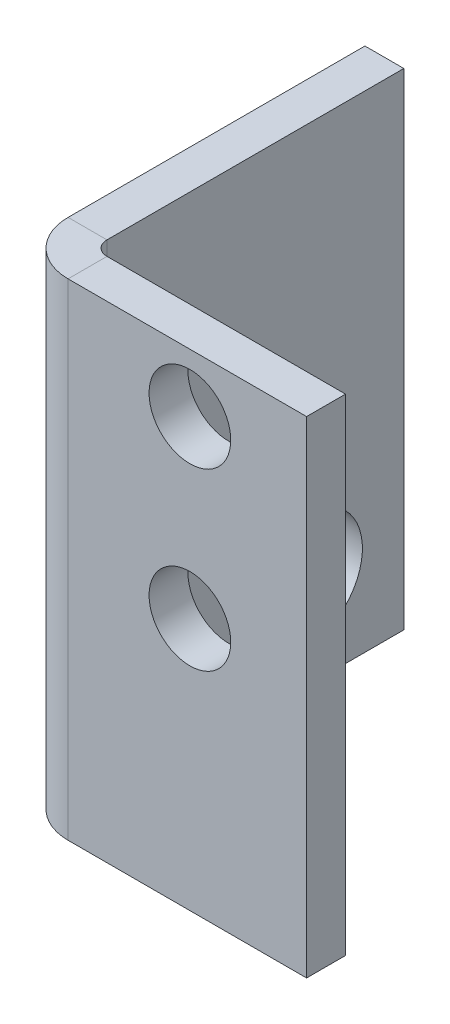
from build123d import *

# Parameters (mm, degrees)
SKETCH_1_W                       = 2
SKETCH_1_H                       = 25
SM_BASE_FLANGE_1_DEPTH           = 22
SM_EDGE_FLANGE_2_STRIP_W         = 9.4732
SM_EDGE_FLANGE_2_STRIP_H         = 2
SM_EDGE_FLANGE_2_STRIP_CUT_DEPTH = 25
SM_EDGE_FLANGE_2_DEPTH           = 25
SKETCH_12_R                      = 3
CUT_EXTRUDE_2_DEPTH              = 10
SKETCH_13_R                      = 2.1
CUT_EXTRUDE_3_DEPTH              = 10
SKETCH_14_W                      = 3.568083007
SKETCH_14_H                      = 26.91386829
CUT_EXTRUDE_4_DEPTH              = 4


# Sheet-metal steps are written as plain solids
with BuildPart() as part:
    # Sketch 1 → 基体-法兰1 (new body)
    with BuildSketch(Plane.XY):
        with Locations((1, 12.5)):
            Rectangle(SKETCH_1_W, SKETCH_1_H)
    extrude(amount=SM_BASE_FLANGE_1_DEPTH)

    # 边线-法兰2 strip (across the edge) → 边线-法兰2 strip cut (cut)
    with BuildSketch(Plane(origin=(2, 25, 22), x_dir=(0, 0, -1), z_dir=(0, -1, 0))):
        with Locations((-2, -1)):
            Rectangle(SM_EDGE_FLANGE_2_STRIP_W, SM_EDGE_FLANGE_2_STRIP_H)
    extrude(amount=SM_EDGE_FLANGE_2_STRIP_CUT_DEPTH, mode=Mode.SUBTRACT)

    # 边线-法兰2 section (across the edge) → 边线-法兰2 (add)
    with BuildSketch(Plane(origin=(2, 25, 22), x_dir=(0, 0, -1), z_dir=(0, -1, 0))):
        with BuildLine():
            Line((0, 0.7366), (0, 13))
            Line((0, 13), (2, 13))
            Line((2, 13), (2, 0.7366))
            ThreePointArc((2, 0.7366), (2.215745145, 0.215745145), (2.7366, 0))
            Line((2.7366, 0), (2.7366, -2))
            ThreePointArc((2.7366, -2), (0.801531583, -1.198468417), (0, 0.7366))
        make_face()
    extrude(amount=SM_EDGE_FLANGE_2_DEPTH)

    # 草图12 → 切除-拉伸2 (cut)
    with BuildSketch(Plane.ZY):
        with Locations((9.13, 4.7)):
            Circle(SKETCH_12_R)
    extrude(amount=-CUT_EXTRUDE_2_DEPTH, mode=Mode.SUBTRACT)

    # 草图13 → 切除-拉伸3 (cut)
    with BuildSketch(Plane(origin=(0, 0, 20), x_dir=(-1, 0, 0), z_dir=(0, 0, -1))):
        with Locations((-9, 13)):
            Circle(SKETCH_13_R)
        with Locations((-9, 22)):
            Circle(SKETCH_13_R)
    extrude(amount=-CUT_EXTRUDE_3_DEPTH, mode=Mode.SUBTRACT)

    # 草图14 → 切除-拉伸4 (cut)
    with BuildSketch(Plane(origin=(0, 0, 0), x_dir=(-1, 0, 0), z_dir=(0, 0, -1))):
        with Locations((-1.784041504, 13.456934145)):
            Rectangle(SKETCH_14_W, SKETCH_14_H)
    extrude(amount=-CUT_EXTRUDE_4_DEPTH, mode=Mode.SUBTRACT)


solid = part.part
